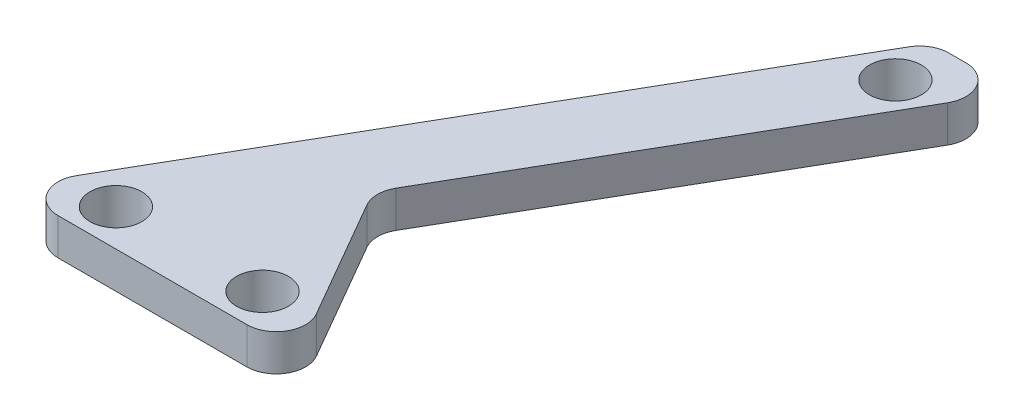
from build123d import *

# Parameters (mm, degrees)
SKETCH1_R           = 2.2479
BOSS_EXTRUDE1_DEPTH = 3.175
SKETCH2_R           = 2.2479
CUT_EXTRUDE1_DEPTH  = 34.750712955
FILLET1_R           = 2.54


with BuildPart() as part:
    # Sketch1 → Boss-Extrude1 (new body)
    with BuildSketch(Plane(origin=(0, 0, 0), x_dir=(1, 0, 0), z_dir=(0, 1, 0))):
        Polygon((14.664696837, 25.4), (-14.664696837, -25.4), (10.500295474, -25.4), (1.583973528, -9.956477372), (21.997045256, 25.4), align=None)
        with Locations((-8.432200682, -22.225)):
            Circle(SKETCH1_R, mode=Mode.SUBTRACT)
        with Locations((4.267799318, -22.225)):
            Circle(SKETCH1_R, mode=Mode.SUBTRACT)
    extrude(amount=BOSS_EXTRUDE1_DEPTH)

    # Sketch2 → Cut-Extrude1 (cut, through all)
    with BuildSketch(Plane(origin=(0, 3.175, 0), x_dir=(1, 0, 0), z_dir=(0, 1, 0))):
        with Locations((15.826827494, 21.062869343)):
            Circle(SKETCH2_R)
    extrude(amount=-CUT_EXTRUDE1_DEPTH, mode=Mode.SUBTRACT)

    # Fillet1
    fillet1_edges = [part.edges().sort_by_distance(p)[0] for p in [
        (14.664696837, 1.5875, -25.4),
        (21.997045256, 1.5875, -25.4),
        (-14.664696837, 1.5875, 25.4),
        (1.583973528, 1.5875, 9.956477372),
        (10.500295474, 1.5875, 25.4),
    ]]
    fillet(fillet1_edges, radius=FILLET1_R)


solid = part.part
